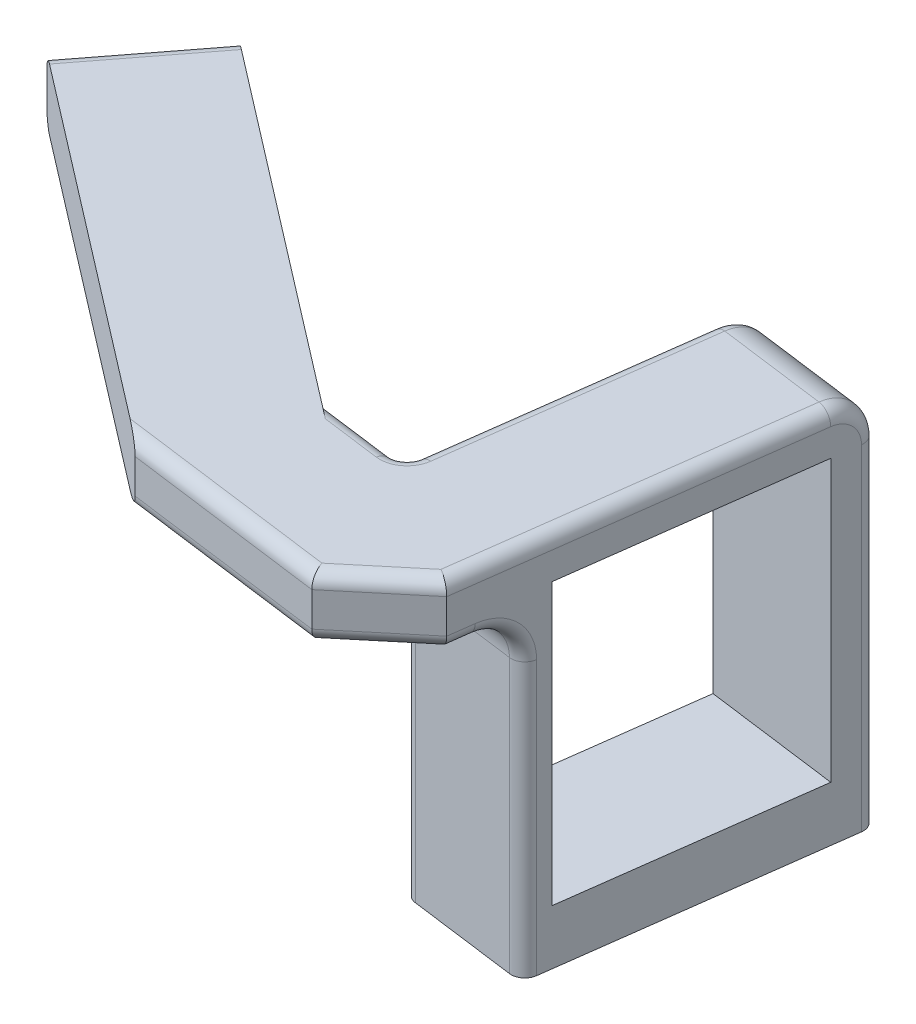
from build123d import *

# Parameters (mm, degrees)
EXTRUDE_THIN1_DEPTH = 27.5
CUT_EXTRUDE1_DEPTH  = 23
CUT_EXTRUDE2_DEPTH  = 2.55
FILLET1_R           = 3
FILLET2_R           = 1
CUT_EXTRUDE3_REACH  = 66.468
SKETCH5_W           = 18.148983488
SKETCH5_H           = 20.5


# Read off the part's stored shape, not the designer's step: Extrude-Thin1
with BuildPart() as part:
    # Extrude-Thin1 outline → Extrude-Thin1 (new body)
    with BuildSketch(Plane(origin=(0, 0, 0), x_dir=(1, 0, 0), z_dir=(0, 1, 0))):
        Polygon((-10.904976106, 11.527203276), (-36.538248885, 31.213507371), (-42.629212569, 23.282545173), (-14.870844874, 1.964172277), (0, 0), (5.378547824, 4.483293206), (9.045002742, 32.242203638), (-0.868893841, 33.551651823), (-3.900133282, 10.601988993), align=None)
    extrude(amount=EXTRUDE_THIN1_DEPTH)

    # Sketch2 → Cut-Extrude1 (cut)
    with BuildSketch(Plane.XZ):
        Polygon((-3.900133282, -10.601988993), (6.0137633, -9.292540808), (4.704315116, 0.621355774), (-14.870844874, -1.964172277), (-42.629212569, -23.282545173), (-36.538248885, -31.213507371), (-10.904976106, -11.527203276), align=None)
    extrude(amount=-CUT_EXTRUDE1_DEPTH, mode=Mode.SUBTRACT)

    # Sketch3 → Cut-Extrude2 (cut)
    with BuildSketch(Plane.XZ):
        with BuildLine():
            Line((3.380947821, -12.850204555), (5.968175927, -24.824313447))
            ThreePointArc((5.968175927, -24.824313447), (3.826164813, -30.914148414), (0.176477543, -25.589293076))
            Line((0.176477543, -25.589293076), (-0.433912303, -13.354079255))
            ThreePointArc((-0.433912303, -13.354079255), (1.241314096, -11.34411656), (3.380947821, -12.850204555))
        make_face()
    extrude(amount=-CUT_EXTRUDE2_DEPTH, mode=Mode.SUBTRACT)

    # Fillet1
    fillet1_edges = [part.edges().sort_by_distance(p)[0] for p in [
        (4.08805445, 27.5, -32.89692773),
        (1.056815009, 23, -9.947264901),
    ]]
    fillet(fillet1_edges, radius=FILLET1_R)

    # Fillet2
    fillet2_edges = [part.edges().sort_by_distance(p)[0] for p in [
        (-3.900133282, 25.25, -10.601988993),
        (-7.435422437, 27.5, -0.982086139),
        (2.689273912, 27.5, -2.241646603),
        (-3.900133282, 10, -10.601988993),
        (-39.583730727, 23, -27.248026272),
        (-7.435422437, 23, -0.982086139),
        (-7.402554694, 27.5, -11.064596135),
        (2.689273912, 23, -2.241646603),
        (-0.868893841, 12.25, -33.551651823),
        (9.045002742, 12.25, -32.242203638),
        (6.0137633, 10, -9.292540808),
        (7.015358055, 27.5, -16.875663935),
        (5.499738334, 23, -5.40083252),
        (8.929944194, 26.621320344, -31.371089714),
        (-2.580930789, 27.5, -20.589735921),
        (-0.983952389, 26.621320344, -32.680537899),
        (5.898704753, 22.121320344, -8.421426884),
        (-4.01519183, 22.121320344, -9.730875069),
        (-39.583730727, 27.5, -27.248026272),
    ]]
    fillet(fillet2_edges, radius=FILLET2_R)

    # Sketch5 → Cut-Extrude3 (cut, up to next)
    with BuildSketch(Plane(origin=(4.704315116, 0, 0.621355774), x_dir=(0.13094481849155867, 0, -0.9913896582626898), z_dir=(0.9913896582626898, 0, 0.13094481849155867)), mode=Mode.PRIVATE) as cut_extrude3_sk1:
        with Locations((21.074491744, 14.25)):
            Rectangle(SKETCH5_W, SKETCH5_H)
    cut_extrude3_tool1 = extrude(cut_extrude3_sk1.sketch, amount=-CUT_EXTRUDE3_REACH, mode=Mode.PRIVATE) & part.part
    add(cut_extrude3_tool1.solids().sort_by_distance((7.463911, 14.25, -20.271677))[0], mode=Mode.SUBTRACT)


solid = part.part
